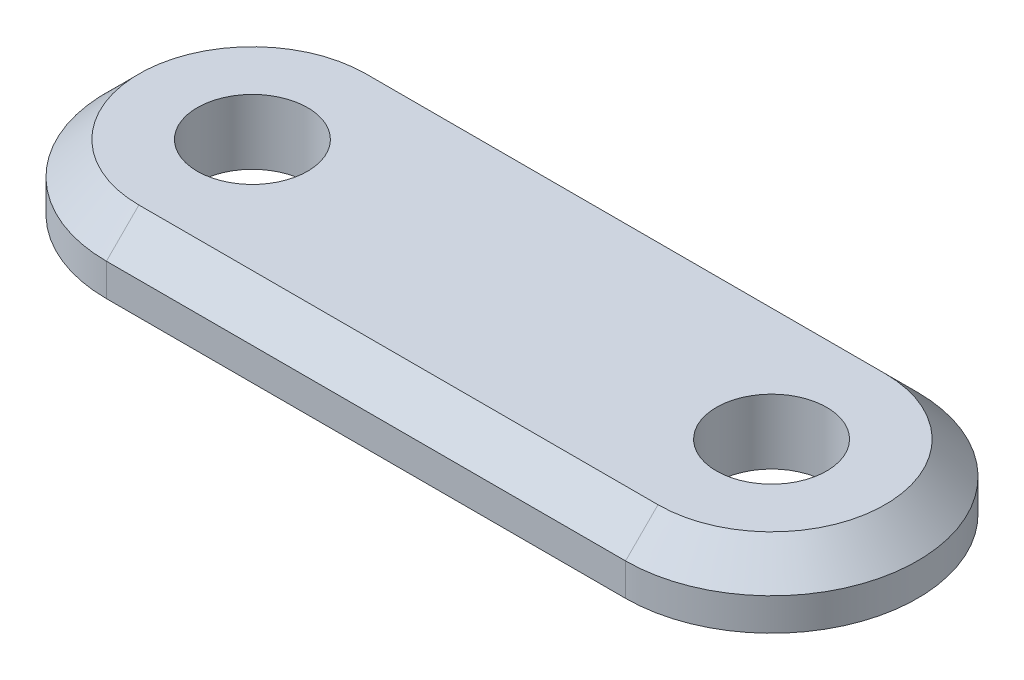
from build123d import *

# Parameters (mm, degrees)
BOSS_EXTRUDE1_DEPTH  = 2
M3_CLEARANCE_HOLE1_D = 3.4
CHAMFER3_SIZE        = 1


with BuildPart() as part:
    # Sketch1 → Boss-Extrude1 (new body)
    with BuildSketch(Plane(origin=(0, 0, 0), x_dir=(1, 0, 0), z_dir=(0, 1, 0))):
        with BuildLine():
            Line((8, -4.5), (-8, -4.5))
            ThreePointArc((-8, -4.5), (-12.5, 0), (-8, 4.5))
            Line((-8, 4.5), (8, 4.5))
            ThreePointArc((8, 4.5), (12.5, 0), (8, -4.5))
        make_face()
    extrude(amount=BOSS_EXTRUDE1_DEPTH)

    # M3 Clearance Hole1 (through all)
    with Locations(Plane(origin=(0, 2, 0), x_dir=(1, 0, 0), z_dir=(0, 1, 0))):
        with Locations((-8, 0), (8, 0)):
            Hole(M3_CLEARANCE_HOLE1_D / 2)

    # Chamfer3
    chamfer3_edges = [part.edges().sort_by_distance(p)[0] for p in [
        (12.5, 2, 0),
        (0, 2, -4.5),
        (-12.5, 2, 0),
        (0, 2, 4.5),
    ]]
    chamfer(chamfer3_edges, length=CHAMFER3_SIZE)


solid = part.part
